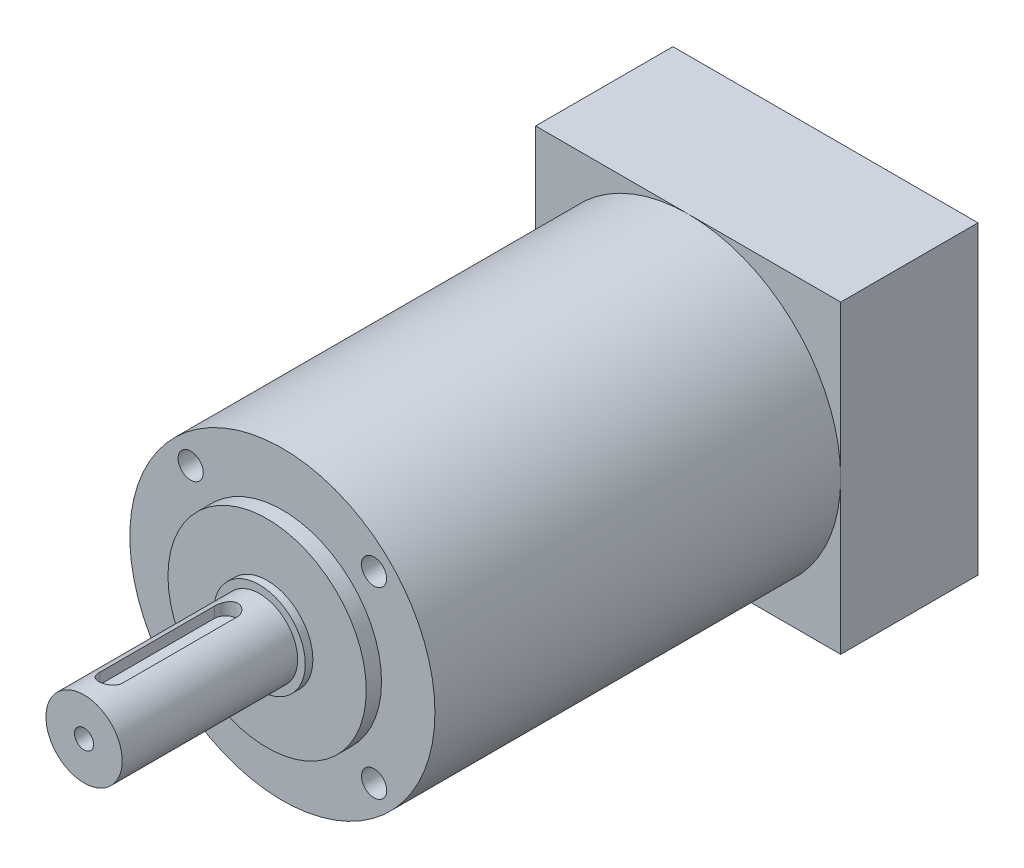
from build123d import *

# Parameters (mm, degrees)
SKETCH_1_W               = 40
SKETCH_1_H               = 40
EXTRUDE_1_DEPTH          = 18
SKETCH_2_R               = 20
EXTRUDE_2_DEPTH          = 53.2
SKETCH_3_R               = 13
EXTRUDE_3_DEPTH          = 2
SKETCH_4_R               = 6
EXTRUDE_4_DEPTH          = 1
SKETCH_5_R               = 5
EXTRUDE_5_DEPTH          = 23
CUT_EXTRUDE_1_DEPTH      = 1.8
HOLE_WIZARD_M31_D        = 2.5
HOLE_WIZARD_M31_DEPTH    = 15
HOLE_WIZARD_M31_TIP      = 0.751075774
PATTERN_CIRCULAR_1_COUNT = 4


with BuildPart() as part:
    # Эскиз1 → Бобышка-Вытянуть1 (new body)
    with BuildSketch(Plane.XY):
        with Locations((20, 20)):
            Rectangle(SKETCH_1_W, SKETCH_1_H)
    extrude(amount=EXTRUDE_1_DEPTH)

    # Эскиз2 → Бобышка-Вытянуть2 (add)
    with BuildSketch(Plane.XY.offset(18)):
        with Locations((20, 20)):
            Circle(SKETCH_2_R)
    extrude(amount=EXTRUDE_2_DEPTH)

    # Эскиз3 → Бобышка-Вытянуть3 (add)
    with BuildSketch(Plane.XY.offset(71.2)):
        with Locations((20, 20)):
            Circle(SKETCH_3_R)
    extrude(amount=EXTRUDE_3_DEPTH)

    # Эскиз4 → Бобышка-Вытянуть4 (add)
    with BuildSketch(Plane.XY.offset(73.2)):
        with Locations((20, 20)):
            Circle(SKETCH_4_R)
    extrude(amount=EXTRUDE_4_DEPTH)

    # Эскиз5 → Бобышка-Вытянуть5 (add)
    with BuildSketch(Plane.XY.offset(74.2)):
        with Locations((20, 20)):
            Circle(SKETCH_5_R)
    extrude(amount=EXTRUDE_5_DEPTH)

    # Эскиз9 → Вырез-Вытянуть1 (cut)
    with BuildSketch(Plane(origin=(0, 25, 0), x_dir=(-1, 0, 0), z_dir=(0, -1, 0))):
        with BuildLine():
            Line((-21.068455004, -93.2), (-21.068455004, -78.2))
            ThreePointArc((-21.068455004, -78.2), (-19.568455004, -76.7), (-18.068455004, -78.2))
            Line((-18.068455004, -78.2), (-18.068455004, -93.2))
            ThreePointArc((-18.068455004, -93.2), (-19.568455004, -94.7), (-21.068455004, -93.2))
        make_face()
    extrude(amount=CUT_EXTRUDE_1_DEPTH, mode=Mode.SUBTRACT)

    # Отверстие обработанное метчиком M31
    with Locations(Plane.XY.offset(97.2)):
        with Locations((20, 20)):
            Hole(HOLE_WIZARD_M31_D / 2, depth=HOLE_WIZARD_M31_DEPTH)
            with Locations((0, 0, -(HOLE_WIZARD_M31_DEPTH + HOLE_WIZARD_M31_TIP / 2))):  # 118° drill point
                Cone(0, HOLE_WIZARD_M31_D / 2, HOLE_WIZARD_M31_TIP, mode=Mode.SUBTRACT)

    # Эскиз14 → Отверстие обработанное метчиком M41 (revolve, cut)
    with BuildSketch(Plane(origin=(7.97918472, 32.02081528, 71.2), x_dir=(0, -1, 0), z_dir=(1, 0, 0))):
        Polygon((0, 0), (0, 7.991420021), (1.65, 7), (1.65, 0), align=None)
    hole_wizard_m41 = revolve(axis=Axis((7.97918472, 32.02081528, 77.55), (0, 0, -1)), mode=Mode.SUBTRACT)

    # Круговой массив1: Отверстие обработанное метчиком M41 ×4 about axis
    pattern_circular_1_axis = Axis((20, 20, 71.2), (0, 0, 1))
    for i in range(1, PATTERN_CIRCULAR_1_COUNT):
        add(hole_wizard_m41.rotate(pattern_circular_1_axis, i * 360 / PATTERN_CIRCULAR_1_COUNT), mode=Mode.SUBTRACT)


solid = part.part
